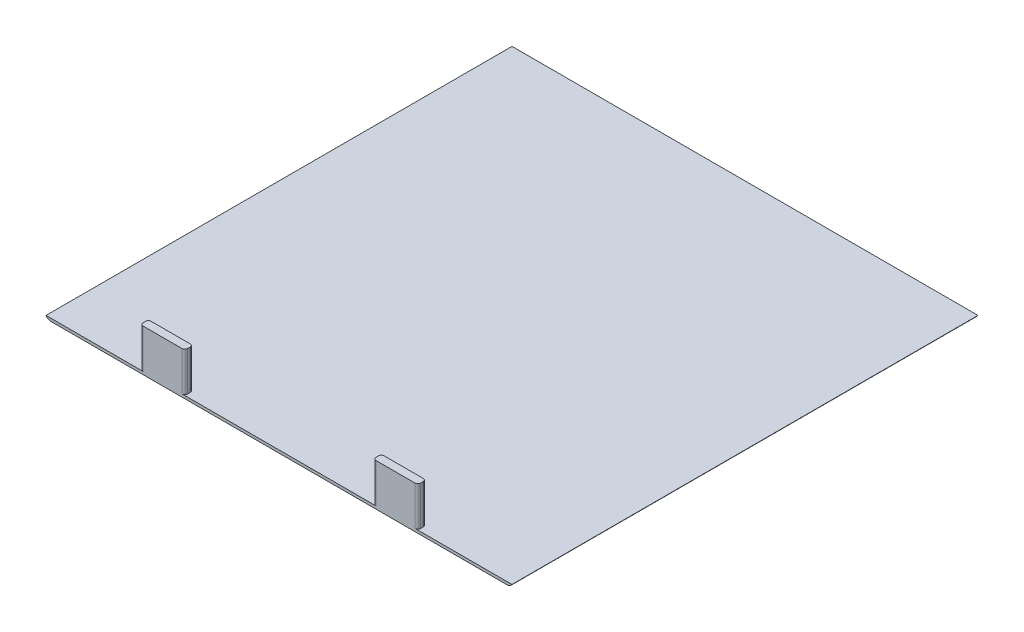
from build123d import *

# Parameters (mm, degrees)
SKETCH1_W           = 210.82
SKETCH1_H           = 210.82
BOSS_EXTRUDE1_DEPTH = 1.27
BOSS_EXTRUDE2_DEPTH = 17.78
SKETCH3_W           = 205.74
SKETCH3_H           = 205.74
SKETCH3_W_2         = 203.2
SKETCH3_H_2         = 203.2
BOSS_EXTRUDE3_DEPTH = 0.508
FILLET1_R           = 2.54
FILLET2_R           = 2.54


with BuildPart() as part:
    # Sketch1 → Boss-Extrude1 (new body)
    with BuildSketch(Plane(origin=(0, 0, 0), x_dir=(1, 0, 0), z_dir=(0, 1, 0))):
        Rectangle(SKETCH1_W, SKETCH1_H)
    extrude(amount=BOSS_EXTRUDE1_DEPTH)

    # Sketch2 → Boss-Extrude2 (add)
    with BuildSketch(Plane(origin=(0, 1.27, 0), x_dir=(1, 0, 0), z_dir=(0, 1, 0))):
        with BuildLine():
            Line((42.6085, -102.997), (42.6085, -104.14))
            ThreePointArc((42.6085, -104.14), (42.980474388, -105.038025612), (43.8785, -105.41))
            Line((43.8785, -105.41), (61.5315, -105.41))
            ThreePointArc((61.5315, -105.41), (62.429525612, -105.038025612), (62.8015, -104.14))
            Line((62.8015, -104.14), (62.8015, -102.997))
            ThreePointArc((62.8015, -102.997), (62.429525612, -102.098974388), (61.5315, -101.727))
            Line((61.5315, -101.727), (43.8785, -101.727))
            ThreePointArc((43.8785, -101.727), (42.980474388, -102.098974388), (42.6085, -102.997))
        make_face()
        with BuildLine():
            Line((-61.5315, -101.727), (-43.8785, -101.727))
            ThreePointArc((-43.8785, -101.727), (-42.980474388, -102.098974388), (-42.6085, -102.997))
            Line((-42.6085, -102.997), (-42.6085, -104.14))
            ThreePointArc((-42.6085, -104.14), (-42.980474388, -105.038025612), (-43.8785, -105.41))
            Line((-43.8785, -105.41), (-61.5315, -105.41))
            ThreePointArc((-61.5315, -105.41), (-62.429525612, -105.038025612), (-62.8015, -104.14))
            Line((-62.8015, -104.14), (-62.8015, -102.997))
            ThreePointArc((-62.8015, -102.997), (-62.429525612, -102.098974388), (-61.5315, -101.727))
        make_face()
    extrude(amount=BOSS_EXTRUDE2_DEPTH)

    # Sketch3 → Boss-Extrude3 (add)
    with BuildSketch(Plane.XZ):
        Rectangle(SKETCH3_W, SKETCH3_H)
        Rectangle(SKETCH3_W_2, SKETCH3_H_2, mode=Mode.SUBTRACT)
    extrude(amount=BOSS_EXTRUDE3_DEPTH)

    # Fillet1
    # the kernel refuses this fillet: 2.54 mm, written as the material it takes off along each edge
    with BuildSketch(Plane(origin=(105.41, 0, -110.909261314), x_dir=(0, 1, 0), z_dir=(0, 0, 1)), Plane(origin=(-110.909261314, 0, -105.41), x_dir=(0, 1, 0), z_dir=(1, 0, 0)), Plane(origin=(-105.41, 0, 110.909261314), x_dir=(0, 1, 0), z_dir=(0, 0, -1))) as fillet1_piece_1:
        with BuildLine():
            CenterArc((2.54, 2.199704526), FILLET1_R, 180, 60)
            Line((0, 2.199704526), (-0.0508, 2.199704526))
            Line((-0.0508, 2.199704526), (-0.0508, 0))
            Line((-0.0508, 0), (0, -0.0508))
            ThreePointArc((0, -0.0508), (0.635, -0.0508), (1.2446, -0.043994091))
            Line((1.2446, -0.043994091), (1.27, 0))
        make_face()
    extrude(amount=221.818522628, mode=Mode.SUBTRACT)

    # Fillet2
    # the kernel refuses this fillet: 2.54 mm, written as the material it takes off along each edge
    with BuildSketch(Plane(origin=(106.68, -0.508, 102.87), x_dir=(0, 1, 0), z_dir=(-1, 0, 0)), Plane(origin=(102.87, -0.508, -106.68), x_dir=(0, 1, 0), z_dir=(0, 0, 1)), Plane(origin=(-106.68, -0.508, -102.87), x_dir=(0, 1, 0), z_dir=(1, 0, 0)), Plane(origin=(-102.87, -0.508, 106.68), x_dir=(0, 1, 0), z_dir=(0, 0, -1))) as fillet2_piece_1:
        with BuildLine():
            CenterArc((2.54, 1.524), FILLET2_R, 180, 36.869897646)
            Line((0, 1.524), (-0.0508, 1.524))
            Line((-0.0508, 1.524), (-0.0508, 0))
            Line((-0.0508, 0), (0, -0.0508))
            ThreePointArc((0, -0.0508), (0.254, -0.0508), (0.46736, -0.03048))
            Line((0.46736, -0.03048), (0.508, 0))
        make_face()
    extrude(amount=213.36, mode=Mode.SUBTRACT)


solid = part.part
